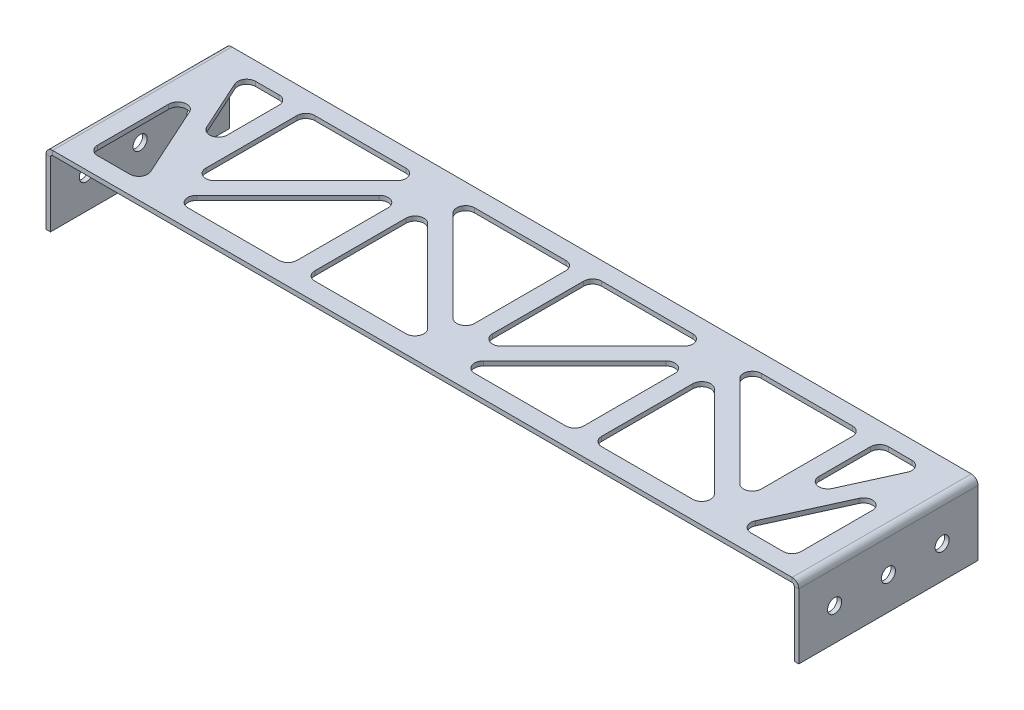
from build123d import *

# Parameters (mm, degrees)
BASE_FLANGE1_DEPTH      = 63.5
CUT_EXTRUDE1_DEPTH      = 276.329439036
CUT_EXTRUDE1_DEPTH_BACK = 276.329439036
SKETCH6_R               = 2.4892
CUT_EXTRUDE2_DEPTH      = 150.865381259
FILLET1_R               = 3.175


# Sheet-metal steps are written as plain solids
with BuildPart() as part:
    # Sketch1 → Base-Flange1 (new body)
    with BuildSketch(Plane.XY):
        with BuildLine():
            Line((-133.35, 0), (-133.35, 23.0505))
            ThreePointArc((-133.35, 23.0505), (-132.661847382, 24.711847382), (-131.0005, 25.4))
            Line((-131.0005, 25.4), (131.0005, 25.4))
            ThreePointArc((131.0005, 25.4), (132.661847382, 24.711847382), (133.35, 23.0505))
            Line((133.35, 23.0505), (133.35, 0))
            Line((133.35, 0), (131.7625, 0))
            Line((131.7625, 0), (131.7625, 23.0505))
            ThreePointArc((131.7625, 23.0505), (131.539315367, 23.589315367), (131.0005, 23.8125))
            Line((131.0005, 23.8125), (-131.0005, 23.8125))
            ThreePointArc((-131.0005, 23.8125), (-131.539315367, 23.589315367), (-131.7625, 23.0505))
            Line((-131.7625, 23.0505), (-131.7625, 0))
            Line((-131.7625, 0), (-133.35, 0))
        make_face()
    extrude(amount=BASE_FLANGE1_DEPTH)

    # Sketch6 → Cut-Extrude1 (cut, two sides: drawn at the far end of the back side and taken through both)
    with BuildSketch(Plane.ZY.offset(133.35).offset(-CUT_EXTRUDE1_DEPTH_BACK)):
        with Locations((12.7, 11.52525)):
            Circle(SKETCH6_R)
        with Locations((50.8, 11.52525)):
            Circle(SKETCH6_R)
        with Locations((31.75, 11.52525)):
            Circle(SKETCH6_R)
    extrude(amount=CUT_EXTRUDE1_DEPTH + CUT_EXTRUDE1_DEPTH_BACK, mode=Mode.SUBTRACT)

    # Sketch7 → Cut-Extrude2 (cut, through all)
    with BuildSketch(Plane(origin=(0, 25.4, 0), x_dir=(1, 0, 0), z_dir=(0, 1, 0))):
        Polygon((-104.775, -42.468871356), (-104.775, -6.35), (-121.163937878, -6.35), align=None)
        Polygon((-124.6505, -57.15), (-105.086562122, -57.15), (-124.6505, -14.033883464), align=None)
        Polygon((-98.425, -49.484871939), (-55.290128061, -6.35), (-98.425, -6.35), align=None)
        Polygon((-97.109871939, -57.15), (-53.975, -57.15), (-53.975, -14.015128061), align=None)
        Polygon((-47.625, -57.15), (-4.490128061, -57.15), (-47.625, -14.015128061), align=None)
        Polygon((-3.175, -49.484871939), (-3.175, -6.35), (-46.309871939, -6.35), align=None)
        Polygon((3.175, -49.484871939), (46.309871939, -6.35), (3.175, -6.35), align=None)
        Polygon((4.490128061, -57.15), (47.625, -57.15), (47.625, -14.015128061), align=None)
        Polygon((105.086562122, -57.15), (124.6505, -57.15), (124.6505, -14.033883464), align=None)
        Polygon((104.775, -42.468871356), (121.163937878, -6.35), (104.775, -6.35), align=None)
        Polygon((55.290128061, -6.35), (98.425, -49.484871939), (98.425, -6.35), align=None)
        Polygon((53.975, -57.15), (97.109871939, -57.15), (53.975, -14.015128061), align=None)
    extrude(amount=-CUT_EXTRUDE2_DEPTH, mode=Mode.SUBTRACT)

    # Fillet1
    fillet1_edges = [part.edges().sort_by_distance(p)[0] for p in [
        (-3.175, 24.60625, 6.35),
        (-3.175, 24.60625, 49.484871939),
        (-46.309871939, 24.60625, 6.35),
        (3.175, 24.60625, 6.35),
        (46.309871939, 24.60625, 6.35),
        (3.175, 24.60625, 49.484871939),
        (47.625, 24.60625, 14.015128061),
        (47.625, 24.60625, 57.15),
        (4.490128061, 24.60625, 57.15),
        (124.6505, 24.60625, 14.033883464),
        (124.6505, 24.60625, 57.15),
        (105.086562122, 24.60625, 57.15),
        (-105.086562122, 24.60625, 57.15),
        (-124.6505, 24.60625, 57.15),
        (-124.6505, 24.60625, 14.033883464),
        (-55.290128061, 24.60625, 6.35),
        (-98.425, 24.60625, 49.484871939),
        (-98.425, 24.60625, 6.35),
        (-53.975, 24.60625, 14.015128061),
        (-53.975, 24.60625, 57.15),
        (-97.109871939, 24.60625, 57.15),
        (-4.490128061, 24.60625, 57.15),
        (-47.625, 24.60625, 57.15),
        (-47.625, 24.60625, 14.015128061),
        (53.975, 24.60625, 14.015128061),
        (97.109871939, 24.60625, 57.15),
        (53.975, 24.60625, 57.15),
        (98.425, 24.60625, 49.484871939),
        (55.290128061, 24.60625, 6.35),
        (98.425, 24.60625, 6.35),
        (121.163937878, 24.60625, 6.35),
        (104.775, 24.60625, 42.468871356),
        (104.775, 24.60625, 6.35),
        (-104.775, 24.60625, 42.468871356),
        (-121.163937878, 24.60625, 6.35),
        (-104.775, 24.60625, 6.35),
    ]]
    fillet(fillet1_edges, radius=FILLET1_R)


solid = part.part
